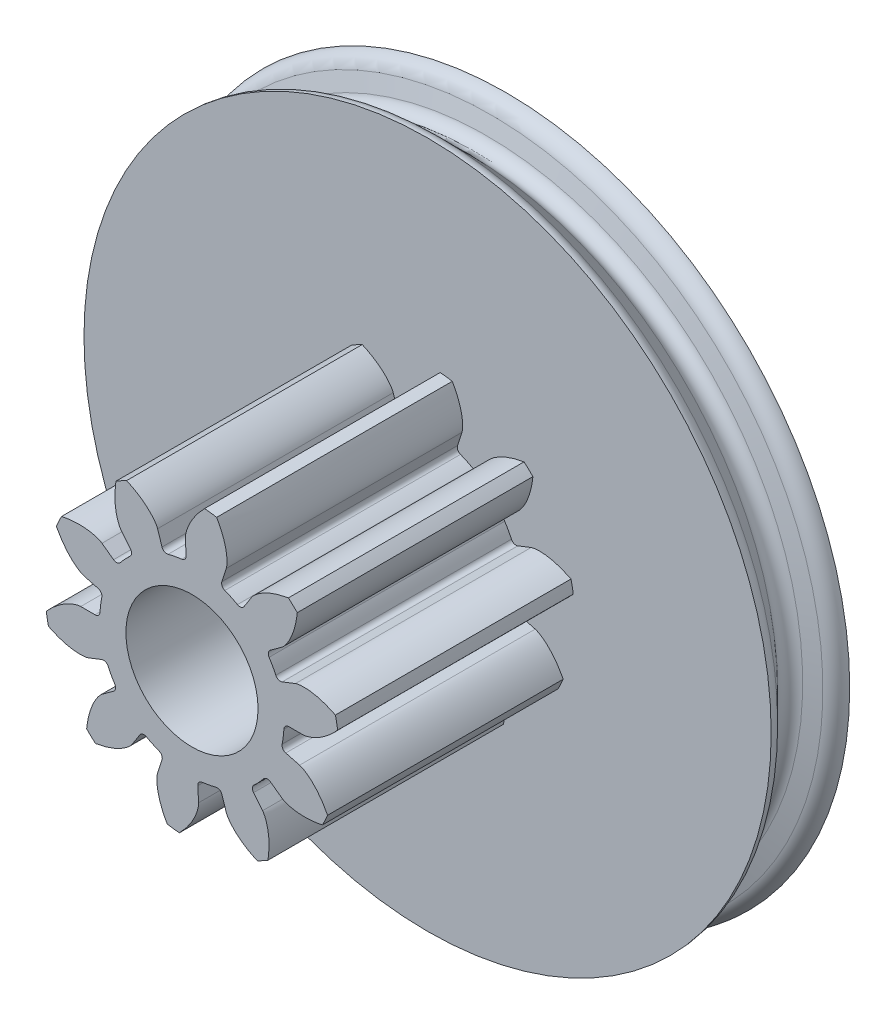
from build123d import *

# Parameters (mm, degrees)
SKETCH2_R                = 7.5
BOSS_EXTRUDE1_DEPTH      = 12
CUT_EXTRUDE1_DEPTH       = 12
FILLET1_R                = 0.254
CIRPATTERN3_COUNT        = 10
FILLET1_OF_CIRPATTERN3_R = 0.254
SKETCH5_R                = 3.3655
CUT_EXTRUDE2_DEPTH       = 30.470324175
FILLET2_R                = 1


# Read off the part's stored shape, not the designer's step: Cut-Extrude1
with BuildPart() as part:
    # Sketch2 → Boss-Extrude1 (new body)
    with BuildSketch(Plane.XY):
        Circle(SKETCH2_R)
    extrude(amount=BOSS_EXTRUDE1_DEPTH)

    # Cut-Extrude1 outline → Cut-Extrude1 (cut)
    with BuildSketch(Plane.XY):
        with BuildLine():
            add(Edge.make_bspline(
                [(6.908254231, -2.919935526), (6.893561306, -2.891484392), (6.858908317, -2.825752949), (6.801030628, -2.719894481), (6.719723085, -2.58478424), (6.626115091, -2.440113011), (6.527745066, -2.302085438), (6.422879078, -2.166713445), (6.314345277, -2.039755658), (6.214137539, -1.933006771), (6.124816582, -1.846052106), (6.048046187, -1.776576314), (5.98307883, -1.721409233), (5.916295348, -1.668340855), (5.847674043, -1.617740845), (5.777181002, -1.569876944), (5.710709014, -1.528901349), (5.648784764, -1.494445809), (5.595035387, -1.467766355), (5.552668527, -1.448973679), (5.518798859, -1.435886737), (5.497736399, -1.428758921), (5.486438018, -1.425539777), (5.482383967, -1.424486414)],
                knots=[0.231950944, 0.231950944, 0.231950944, 0.231950944, 0.231950944, 0.273661934, 0.328394301, 0.383126635, 0.43785898, 0.492591256, 0.547323565, 0.602055884, 0.652783571, 0.680149903, 0.707515961, 0.734882063, 0.762248421, 0.789614741, 0.816980391, 0.844236067, 0.862480777, 0.880559096, 0.894007228, 0.903714168, 0.909090916, 0.909090916, 0.909090916, 0.909090916, 0.909090916], degree=4))
            ThreePointArc((6.908254231, -2.919935526), (7.439498394, -0.950717438), (7.420544998, 1.088812167))
            add(Edge.make_bspline(
                [(5.664423669, 0), (5.668612333, 0), (5.680357163, 0.000274378), (5.702535229, 0.001876348), (5.738607513, 0.006025183), (5.784338786, 0.013559515), (5.843070135, 0.025864695), (5.911669164, 0.043640245), (5.986309439, 0.066582649), (6.066573808, 0.095180776), (6.14571467, 0.126897783), (6.223697515, 0.161466007), (6.300450382, 0.198522205), (6.392225315, 0.246459047), (6.500543047, 0.308156828), (6.624375527, 0.386274894), (6.761348618, 0.481858566), (6.896887768, 0.586508412), (7.026807544, 0.695362097), (7.153789071, 0.811843482), (7.266461058, 0.922164454), (7.349099945, 1.010065857), (7.399169388, 1.064970348), (7.420544998, 1.088812167)],
                knots=[0, 0, 0, 0, 0, 0.005376748, 0.015083688, 0.02853182, 0.046610139, 0.064854849, 0.092110525, 0.119476175, 0.146842495, 0.174208853, 0.201574955, 0.228941013, 0.256307345, 0.307035032, 0.361767351, 0.41649966, 0.471231936, 0.525964281, 0.580696615, 0.635428982, 0.677139972, 0.677139972, 0.677139972, 0.677139972, 0.677139972], degree=4))
            Line((5.664423669, 0), (4.6875, 0))
            ThreePointArc((4.6875, 0), (4.649686496, -0.594198398), (4.536856059, -1.178810141))
            Line((4.536856059, -1.178810141), (5.482383967, -1.424486414))
        make_face()
    cut_extrude1 = extrude(amount=CUT_EXTRUDE1_DEPTH, mode=Mode.SUBTRACT)

    # Fillet1
    fillet1_edges = [part.edges().sort_by_distance(p)[0] for p in [
        (4.536856059, -1.178810141, 6),
        (4.6875, 0, 6),
    ]]
    fillet(fillet1_edges, radius=FILLET1_R)

    # CirPattern3: Cut-Extrude1 ×10 about axis
    cirpattern3_axis = Axis((0, 0, 55), (0, 0, -1))
    for i in range(1, CIRPATTERN3_COUNT):
        add(cut_extrude1.rotate(cirpattern3_axis, i * 360 / CIRPATTERN3_COUNT), mode=Mode.SUBTRACT)

    # Fillet1 of CirPattern3
    fillet1_of_cirpattern3_edges = [part.edges().sort_by_distance(p)[0] for p in [
        (2.977506437, -3.62037452, 6),
        (3.792267161, -2.75524337, 6),
        (0.280850557, -4.679078885, 6),
        (1.448517161, -4.45807742, 6),
        (-2.523080689, -3.950534152, 6),
        (-1.448517161, -4.45807742, 6),
        (-4.363280869, -1.713019646, 6),
        (-3.792267161, -2.75524337, 6),
        (-4.536856059, 1.178810141, 6),
        (-4.6875, 0, 6),
        (-2.977506437, 3.62037452, 6),
        (-3.792267161, 2.75524337, 6),
        (-0.280850557, 4.679078885, 6),
        (-1.448517161, 4.45807742, 6),
        (2.523080689, 3.950534152, 6),
        (1.448517161, 4.45807742, 6),
        (4.363280869, 1.713019646, 6),
        (3.792267161, 2.75524337, 6),
    ]]
    fillet(fillet1_of_cirpattern3_edges, radius=FILLET1_OF_CIRPATTERN3_R)

    # Sketch4 → Revolve1 (revolve)
    with BuildSketch(Plane(origin=(0, 0, 0), x_dir=(1, 0, 0), z_dir=(0, 1, 0))):
        with BuildLine():
            Line((0, 0), (-17.5, 0))
            ThreePointArc((-17.5, 0), (-17.439103626, 0.306146746), (-17.265685425, 0.565685425))
            Line((-17.265685425, 0.565685425), (-15.825627707, 2.005743143))
            ThreePointArc((-15.825627707, 2.005743143), (-15.670336279, 2.585298639), (-16.094600348, 3.009562708))
            Line((-16.094600348, 3.009562708), (-16.907055236, 3.227259339))
            ThreePointArc((-16.907055236, 3.227259339), (-17.334682672, 3.512990857), (-17.5, 4))
            Line((-17.5, 4), (0, 4))
            Line((0, 4), (0, 0))
        make_face()
    revolve(axis=Axis((0, 0, -4), (0, 0, 1)))

    # Sketch5 → Cut-Extrude2 (cut, through all)
    with BuildSketch(Plane.XY.offset(12)):
        Circle(SKETCH5_R)
    extrude(amount=-CUT_EXTRUDE2_DEPTH, mode=Mode.SUBTRACT)

    # Fillet2
    fillet2_edges = [part.edges().sort_by_distance(p)[0] for p in [
        (-3.3655, 0, -4),
    ]]
    fillet(fillet2_edges, radius=FILLET2_R)


solid = part.part
